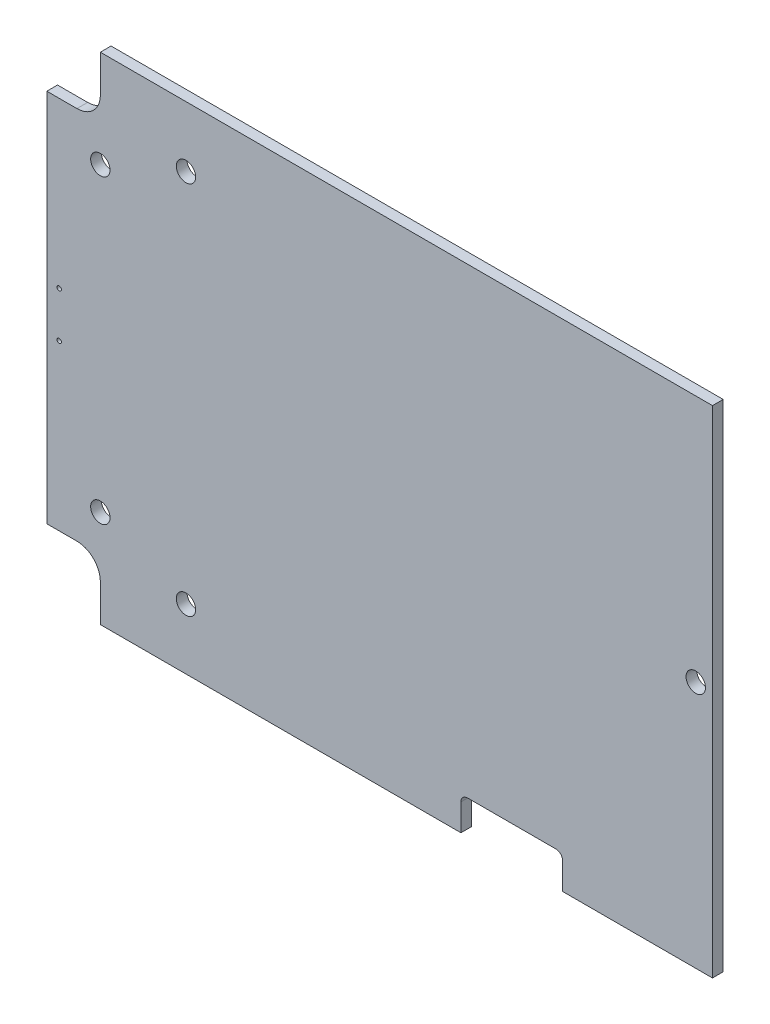
from build123d import *

# Parameters (mm, degrees)
BOSS_EXTRUDE1_DEPTH    = 1.6
M2_5_CLEARANCE_HOLE1_D = 2.9
SKETCH5_W              = 47.55
SKETCH5_H              = 74.1
CUT_EXTRUDE1_DEPTH     = 398.978628668
SKETCH6_R              = 0.325
CUT_EXTRUDE2_DEPTH     = 352.103479166
CUT_EXTRUDE3_DEPTH     = 352.103479166


with BuildPart() as part:
    # Sketch2 → Boss-Extrude1 (new body)
    with BuildSketch(Plane.XY):
        with BuildLine():
            Line((371.950402667, 62.730474091), (253.950402667, 62.730474091))
            Line((253.950402667, 62.730474091), (253.950402667, 57.180474091))
            ThreePointArc((253.950402667, 57.180474091), (252.925276401, 54.705600357), (250.450402667, 53.680474091))
            Line((250.450402667, 53.680474091), (245.950402667, 53.680474091))
            Line((245.950402667, 53.680474091), (245.950402667, -2.319525909))
            Line((245.950402667, -2.319525909), (250.450402667, -2.319525909))
            ThreePointArc((250.450402667, -2.319525909), (252.925276401, -3.344652175), (253.950402667, -5.819525909))
            Line((253.950402667, -5.819525909), (253.950402667, -11.369525909))
            Line((253.950402667, -11.369525909), (371.950402667, -11.369525909))
            Line((371.950402667, -11.369525909), (371.950402667, -5.819525909))
            ThreePointArc((371.950402667, -5.819525909), (375.450402667, -2.319525909), (378.950402667, -5.819525909))
            Line((378.950402667, -5.819525909), (378.950402667, -11.369525909))
            Line((378.950402667, -11.369525909), (393.000402667, -11.369525909))
            Line((393.000402667, -11.369525909), (393.000402667, 62.730474091))
            Line((393.000402667, 62.730474091), (378.950402667, 62.730474091))
            Line((378.950402667, 62.730474091), (378.950402667, 57.180474091))
            ThreePointArc((378.950402667, 57.180474091), (375.450402667, 53.680474091), (371.950402667, 57.180474091))
            Line((371.950402667, 57.180474091), (371.950402667, 62.730474091))
        make_face()
    extrude(amount=BOSS_EXTRUDE1_DEPTH)

    # M2.5 Clearance Hole1 (through all)
    with Locations(Plane.XY.offset(1.6)):
        with Locations((347.250402667, -2.319525909), (342.950402667, 25.680474091), (347.250402667, 53.680474091), (266.750402667, -2.319525909), (253.950402667, 3.180474091), (266.750402667, 53.680474091), (253.950402667, 48.180474091)):
            Hole(M2_5_CLEARANCE_HOLE1_D / 2)

    # Sketch5 → Cut-Extrude1 (cut, through all)
    with BuildSketch(Plane.XY.offset(1.6)):
        with Locations((369.225402667, 25.680474091)):
            Rectangle(SKETCH5_W, SKETCH5_H)
    extrude(amount=-CUT_EXTRUDE1_DEPTH, mode=Mode.SUBTRACT)

    # Sketch6 → Cut-Extrude2 (cut, through all)
    with BuildSketch(Plane(origin=(0, 0, 0), x_dir=(-1, 0, 0), z_dir=(0, 0, -1))):
        with Locations((-247.800502667, 29.080474091)):
            Circle(SKETCH6_R)
        with Locations((-247.800502667, 22.280474091)):
            Circle(SKETCH6_R)
    extrude(amount=-CUT_EXTRUDE2_DEPTH, mode=Mode.SUBTRACT)

    # Sketch7 → Cut-Extrude3 (cut, through all)
    with BuildSketch(Plane(origin=(0, 0, 0), x_dir=(-1, 0, 0), z_dir=(0, 0, -1))):
        with BuildLine():
            Line((-307.850402667, -7.369525909), (-307.850402667, -12.319525909))
            Line((-307.850402667, -12.319525909), (-323.050402667, -12.319525909))
            Line((-323.050402667, -12.319525909), (-323.050402667, -7.369525909))
            ThreePointArc((-323.050402667, -7.369525909), (-322.757509449, -6.662419128), (-322.050402667, -6.369525909))
            Line((-322.050402667, -6.369525909), (-308.850402667, -6.369525909))
            ThreePointArc((-308.850402667, -6.369525909), (-308.143295886, -6.662419128), (-307.850402667, -7.369525909))
        make_face()
    extrude(amount=-CUT_EXTRUDE3_DEPTH, mode=Mode.SUBTRACT)


solid = part.part
